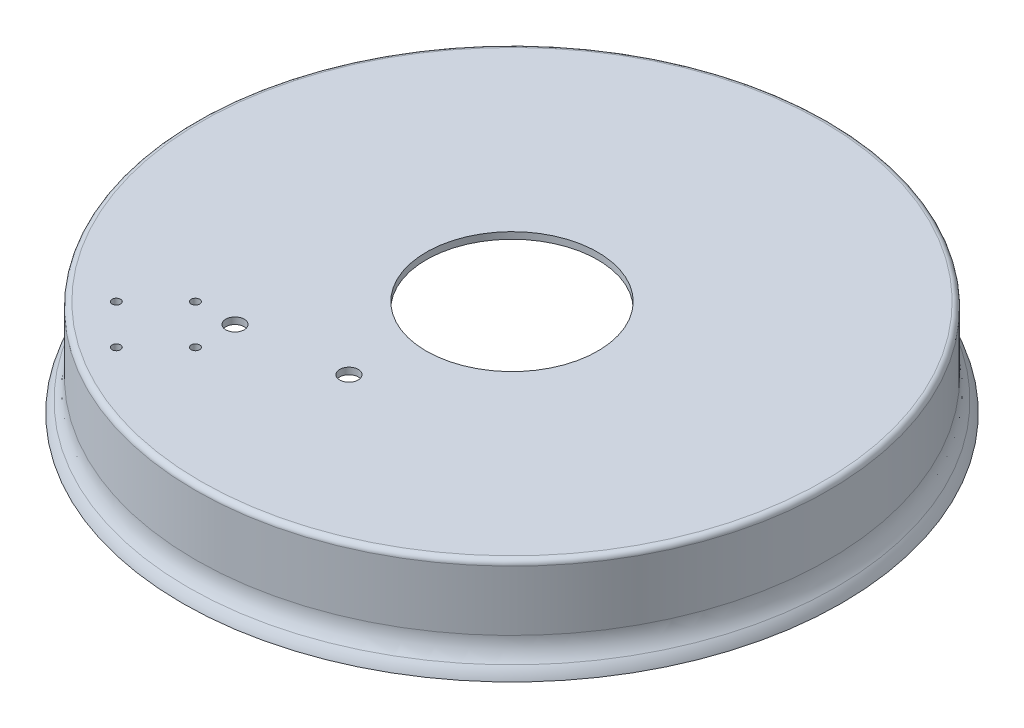
from build123d import *

# Parameters (mm, degrees)
SKETCH1_R           = 120
SKETCH1_R_2         = 118
BOSS_EXTRUDE1_DEPTH = 32
SKETCH2_R           = 120
SKETCH2_R_2         = 32.5
BOSS_EXTRUDE2_DEPTH = 2.5
SKETCH3_R           = 1.6
CUT_EXTRUDE1_DEPTH  = 2.5
SKETCH4_R           = 3.5
CUT_EXTRUDE2_DEPTH  = 2.5
FILLET1_R           = 2
BOSS_EXTRUDE3_START = 2
SKETCH5_R           = 125
SKETCH5_R_2         = 118
BOSS_EXTRUDE3_DEPTH = 2
FILLET2_R           = 12
FILLET3_R           = 12
SKETCH6_R           = 3.5
CUT_EXTRUDE3_DEPTH  = 26


with BuildPart() as part:
    # Sketch1 → Boss-Extrude1 (new body)
    with BuildSketch(Plane(origin=(0, 0, 0), x_dir=(1, 0, 0), z_dir=(0, 1, 0))):
        with Locations(Location((0, 0, 0), (0, 0, 270))):
            Circle(SKETCH1_R)
        with Locations(Location((0, 0, 0), (0, 0, 270))):
            Circle(SKETCH1_R_2, mode=Mode.SUBTRACT)
    extrude(amount=BOSS_EXTRUDE1_DEPTH)

    # Sketch2 → Boss-Extrude2 (add)
    with BuildSketch(Plane(origin=(0, 32, 0), x_dir=(1, 0, 0), z_dir=(0, 1, 0))):
        with Locations(Location((0, 0, 0), (0, 0, 270))):
            Circle(SKETCH2_R)
        with Locations(Location((0, 0, 0), (0, 0, 270))):
            Circle(SKETCH2_R_2, mode=Mode.SUBTRACT)
    extrude(amount=BOSS_EXTRUDE2_DEPTH)

    # Sketch3 → Cut-Extrude1 (cut)
    with BuildSketch(Plane(origin=(0, 34.5, 0), x_dir=(1, 0, 0), z_dir=(0, 1, 0))):
        with Locations(Location((-75, -75, 0), (0, 0, 270))):
            Circle(SKETCH3_R)
        with Locations(Location((-60, -60, 0), (0, 0, 270))):
            Circle(SKETCH3_R)
        with Locations(Location((-45, -75, 0), (0, 0, 270))):
            Circle(SKETCH3_R)
        with Locations(Location((-60, -90, 0), (0, 0, 270))):
            Circle(SKETCH3_R)
    extrude(amount=-CUT_EXTRUDE1_DEPTH, mode=Mode.SUBTRACT)

    # Sketch4 → Cut-Extrude2 (cut)
    with BuildSketch(Plane(origin=(0, 34.5, 0), x_dir=(1, 0, 0), z_dir=(0, 1, 0))):
        with Locations(Location((-45, -60, 0), (0, 0, 270))):
            Circle(SKETCH4_R)
    extrude(amount=-CUT_EXTRUDE2_DEPTH, mode=Mode.SUBTRACT)

    # Fillet1
    fillet1_edges = [part.edges().sort_by_distance(p)[0] for p in [
        (0, 34.5, -120),
    ]]
    fillet(fillet1_edges, radius=FILLET1_R)

    # Sketch5 → Boss-Extrude3 (add)
    with BuildSketch(Plane.XZ.offset(BOSS_EXTRUDE3_START)):
        with Locations(Location((0, 0, 0), (0, 0, 270))):
            Circle(SKETCH5_R)
        with Locations(Location((0, 0, 0), (0, 0, 270))):
            Circle(SKETCH5_R_2, mode=Mode.SUBTRACT)
    extrude(amount=-BOSS_EXTRUDE3_DEPTH)

    # Fillet2
    # the kernel refuses this fillet: 12 mm, written as the material it adds along each edge
    with BuildSketch(Plane(origin=(0, 0, 0), x_dir=(0, 0, 1), z_dir=(-1, 0, 0))) as fillet2_piece_1:
        with BuildLine():
            CenterArc((132, 9.746794345), FILLET2_R, 180, 54.314665287)
            Line((125, 0), (124.86, -0.194935887))
            ThreePointArc((124.86, -0.194935887), (122.5, -0.24), (120, -0.24))
            Line((120, -0.24), (119.76, 0))
            Line((119.76, 0), (119.76, 9.746794345))
            Line((119.76, 9.746794345), (120, 9.746794345))
        make_face()
    revolve(axis=Axis((0, 0, 0), (0, 1, 0)))

    # Fillet3
    # the kernel refuses this fillet: 12 mm, written as the material it takes off along each edge
    with BuildSketch(Plane(origin=(0, 0, 0), x_dir=(0, 0, -1), z_dir=(-1, 0, 0))) as fillet3_piece_1:
        with BuildLine():
            CenterArc((113.555602764, 5.609123427), FILLET3_R, 320.220862726, 22.275863923)
            Line((125, 2), (125.228887945, 1.927817531))
            ThreePointArc((125.228887945, 1.927817531), (125.24, 1), (125.24, 0))
            Line((125.24, 0), (125.14, -0.194935887))
            ThreePointArc((125.14, -0.194935887), (123.986742364, -1.139512424), (122.962245354, -2.222394637))
            Line((122.962245354, -2.222394637), (122.777801382, -2.068835459))
        make_face()
    revolve(axis=Axis((0, 0, 0), (0, -1, 0)), revolution_arc=180, mode=Mode.SUBTRACT)
    with BuildSketch(Plane(origin=(0, 0, 0), x_dir=(0, 0, 1), z_dir=(1, 0, 0))) as fillet3_piece_2:
        with BuildLine():
            CenterArc((113.555602764, 5.609123427), FILLET3_R, 320.220862726, 22.275863923)
            Line((125, 2), (125.228887945, 1.927817531))
            ThreePointArc((125.228887945, 1.927817531), (125.24, 1), (125.24, 0))
            Line((125.24, 0), (125.14, -0.194935887))
            ThreePointArc((125.14, -0.194935887), (123.986742364, -1.139512424), (122.962245354, -2.222394637))
            Line((122.962245354, -2.222394637), (122.777801382, -2.068835459))
        make_face()
    revolve(axis=Axis((0, 0, 0), (0, -1, 0)), revolution_arc=180, mode=Mode.SUBTRACT)

    # Sketch6 → Cut-Extrude3 (cut)
    with BuildSketch(Plane(origin=(0, 34.5, 0), x_dir=(1, 0, 0), z_dir=(0, 1, 0))):
        with Locations(Location((-6.916242645, -54.877422457, 0), (0, 0, 270))):
            Circle(SKETCH6_R)
    extrude(amount=-CUT_EXTRUDE3_DEPTH, mode=Mode.SUBTRACT)


solid = part.part
